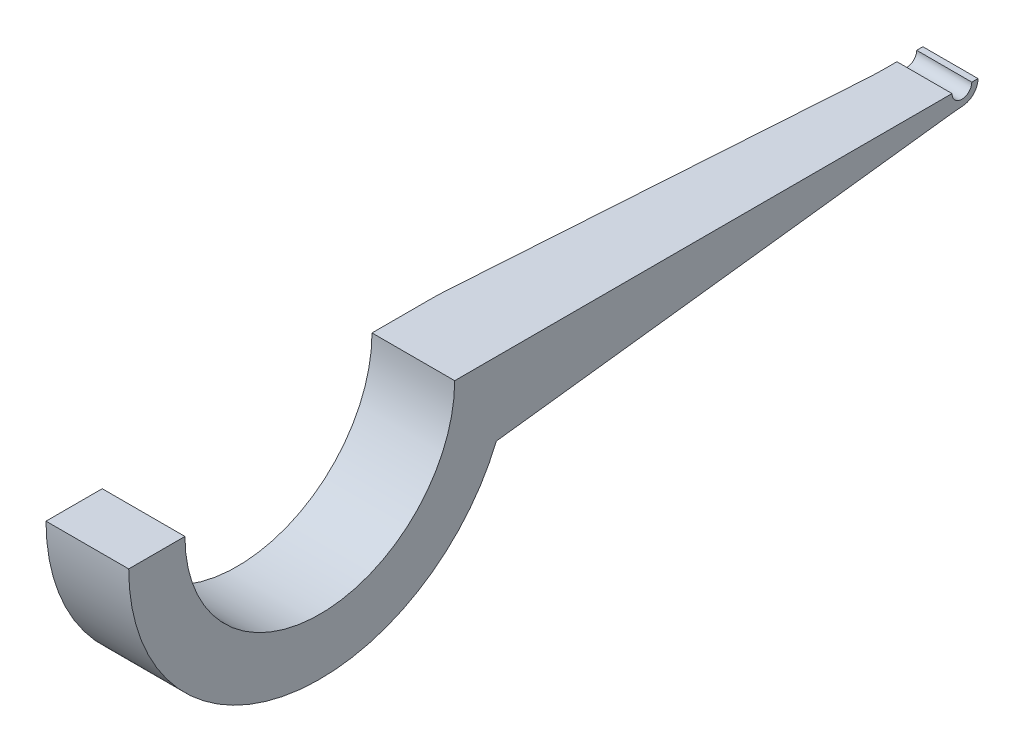
from build123d import *

# Parameters (mm, degrees)
BOSS_EXTRUDE1_DEPTH = 22.5


with BuildPart() as part:
    # Rim Base → Boss-Extrude1 (new body)
    with BuildSketch(Plane(origin=(1321.912730889, 0, 0), x_dir=(0, -1, 0), z_dir=(-1, 0, 0))):
        with BuildLine():
            Line((-601.912701968, 739.677774747), (-601.912701968, 737.991974747))
            ThreePointArc((-601.912701968, 737.991974747), (-598.958442816, 739.140060143), (-597.554694196, 741.981756297))
            ThreePointArc((-597.554694196, 741.981756297), (-597.301358181, 744.592570386), (-597.003330929, 747.198661155))
            Line((-597.003330929, 747.198661155), (-582.013163485, 869.025239056))
            ThreePointArc((-582.013163485, 869.025239056), (-550.911867387, 927.211671492), (-601.912701968, 969.066974747))
            Line((-601.912701968, 969.066974747), (-601.912701968, 953.766974747))
            ThreePointArc((-601.912701968, 953.766974747), (-565.212701968, 917.066974747), (-601.912701968, 880.366974747))
            Line((-601.912701968, 880.366974747), (-601.912701968, 745.056174747))
            ThreePointArc((-601.912701968, 745.056174747), (-599.223501968, 742.366974747), (-601.912701968, 739.677774747))
        make_face()
    extrude(amount=BOSS_EXTRUDE1_DEPTH)

    # Sketch1 → Cut-Revolve1 (revolve, cut)
    with BuildSketch(Plane(origin=(0, 601.912701968, 0), x_dir=(1, 0, 0), z_dir=(0, 1, 0))):
        with BuildLine():
            Line((1306.912730889, -737.991974747), (1299.412730889, -737.991974747))
            Line((1299.412730889, -737.991974747), (1299.412730889, -739.677774747))
            Line((1299.412730889, -739.677774747), (1299.412730889, -745.056174747))
            Line((1299.412730889, -745.056174747), (1299.412730889, -865.066974747))
            ThreePointArc((1299.412730889, -865.066974747), (1299.457666984, -862.385975682), (1299.592424789, -859.707988459))
            Line((1299.592424789, -859.707988459), (1306.73303699, -753.350961035))
            ThreePointArc((1306.73303699, -753.350961035), (1306.867794794, -750.672973811), (1306.912730889, -747.991974747))
            Line((1306.912730889, -747.991974747), (1306.912730889, -737.991974747))
        make_face()
    revolve(axis=Axis((1299.412730889, 601.912701968, 917.066974747), (1, 0, 0)), mode=Mode.SUBTRACT)


solid = part.part
